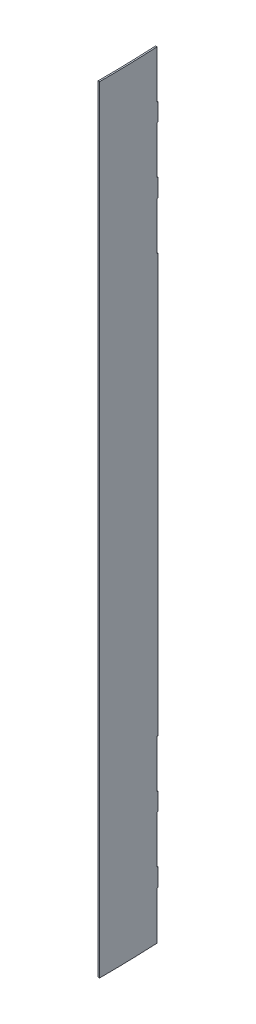
from build123d import *

# Parameters (mm, degrees)
BASE_FLANGE1_DEPTH        = 130
UNFOLD1_DEPTH             = 130
UNFOLD1_2_DEPTH           = 130
SKETCH6_W                 = 0.3
SKETCH6_H                 = 8
CUT_EXTRUDE1_DEPTH        = 235.985371885
LPATTERN1_COUNT           = 3
LPATTERN1_PITCH           = 11
LPATTERN2_COUNT           = 3
LPATTERN2_PITCH           = 100
LPATTERN2_COPY_1_SKETCH_W = 0.3
LPATTERN2_COPY_1_SKETCH_H = 8
LPATTERN2_COPY_1_DEPTH    = 235.985371885
LPATTERN2_COPY_2_SKETCH_W = 0.3
LPATTERN2_COPY_2_SKETCH_H = 8
LPATTERN2_COPY_2_DEPTH    = 235.985371885
LPATTERN2_COPY_3_SKETCH_W = 0.3
LPATTERN2_COPY_3_SKETCH_H = 8
LPATTERN2_COPY_3_DEPTH    = 235.985371885
LPATTERN2_COPY_4_SKETCH_W = 0.3
LPATTERN2_COPY_4_SKETCH_H = 8
LPATTERN2_COPY_4_DEPTH    = 235.985371885
FOLD1_DEPTH               = 130
FOLD1_2_DEPTH             = 130
FOLD1_START               = 30
FOLD1_3_DEPTH             = 70
FOLD1_START_2             = 8
FOLD1_4_DEPTH             = 3
FOLD1_START_3             = 19
FOLD1_5_DEPTH             = 3
FOLD1_START_4             = 108
FOLD1_6_DEPTH             = 3
FOLD1_START_5             = 119
FOLD1_7_DEPTH             = 3


# Read off the part's stored shape, not the designer's step: Unfold1, Fold1
# Sheet-metal steps are written as plain solids
with BuildPart() as part:
    # Sketch1 → Base-Flange1 (new body)
    with BuildSketch(Plane(origin=(0, 0, 0), x_dir=(1, 0, 0), z_dir=(0, 1, 0))):
        with BuildLine():
            ThreePointArc((195.5, 0), (195.436009031, 5.001637134), (195.244078015, 10))
            Line((195.244078015, 10), (195.493750749, 10.012787724))
            ThreePointArc((195.493750749, 10.012787724), (195.685927201, 5.008033089), (195.75, 0))
            Line((195.75, 0), (195.5, 0))
        make_face()
    extrude(amount=BASE_FLANGE1_DEPTH)

    # Unfold1 outline → Unfold1 (cut)
    with BuildSketch(Plane(origin=(0, 0, 0), x_dir=(1, 0, 0), z_dir=(0, 1, 0))):
        with BuildLine():
            Line((195.5, 0), (195.5, 9.890020218))
            ThreePointArc((195.5, 9.890020218), (195.496885011, 9.951404462), (195.493750749, 10.012787724))
            Line((195.493750749, 10.012787724), (195.244078015, 10))
            ThreePointArc((195.244078015, 10), (195.436009031, 5.001637134), (195.5, 0))
        make_face()
    extrude(amount=UNFOLD1_DEPTH, mode=Mode.SUBTRACT)

    # Unfold1 2 outline → Unfold1 2 (add)
    with BuildSketch(Plane(origin=(0, 0, 0), x_dir=(1, 0, 0), z_dir=(0, 1, 0))):
        with BuildLine():
            Line((195.75, 0), (195.75, 10.010762486))
            Line((195.75, 10.010762486), (195.5, 10.010762486))
            Line((195.5, 10.010762486), (195.5, 9.890020218))
            ThreePointArc((195.5, 9.890020218), (195.687490019, 4.946589732), (195.75, 0))
        make_face()
    extrude(amount=UNFOLD1_2_DEPTH)

    # Sketch6 → Cut-Extrude1 (cut, symmetric)
    with BuildSketch(Plane(origin=(195.75, 0, -195.75), x_dir=(0, 0, 1), z_dir=(-1, 0, 0))):
        with Locations((185.739237514, 126)):
            Rectangle(SKETCH6_W, SKETCH6_H)
    cut_extrude1 = extrude(amount=CUT_EXTRUDE1_DEPTH, both=True, mode=Mode.SUBTRACT)

    # LPattern1: Cut-Extrude1 ×3
    with Locations(*[(0, -i * LPATTERN1_PITCH, 0) for i in range(1, LPATTERN1_COUNT)]):
        add(cut_extrude1, mode=Mode.SUBTRACT)

    # LPattern2: Cut-Extrude1 ×3
    with Locations(*[(0, -i * LPATTERN2_PITCH, 0) for i in range(1, LPATTERN2_COUNT)]):
        add(cut_extrude1, mode=Mode.SUBTRACT)

    # LPattern2 copy 1 sketch → LPattern2 copy 1 (cut, symmetric)
    with BuildSketch(Plane(origin=(195.75, -111, -195.75), x_dir=(0, 0, 1), z_dir=(-1, 0, 0))):
        with Locations((185.739237514, 126)):
            Rectangle(LPATTERN2_COPY_1_SKETCH_W, LPATTERN2_COPY_1_SKETCH_H)
    extrude(amount=LPATTERN2_COPY_1_DEPTH, both=True, mode=Mode.SUBTRACT)

    # LPattern2 copy 2 sketch → LPattern2 copy 2 (cut, symmetric)
    with BuildSketch(Plane(origin=(195.75, -211, -195.75), x_dir=(0, 0, 1), z_dir=(-1, 0, 0))):
        with Locations((185.739237514, 126)):
            Rectangle(LPATTERN2_COPY_2_SKETCH_W, LPATTERN2_COPY_2_SKETCH_H)
    extrude(amount=LPATTERN2_COPY_2_DEPTH, both=True, mode=Mode.SUBTRACT)

    # LPattern2 copy 3 sketch → LPattern2 copy 3 (cut, symmetric)
    with BuildSketch(Plane(origin=(195.75, -122, -195.75), x_dir=(0, 0, 1), z_dir=(-1, 0, 0))):
        with Locations((185.739237514, 126)):
            Rectangle(LPATTERN2_COPY_3_SKETCH_W, LPATTERN2_COPY_3_SKETCH_H)
    extrude(amount=LPATTERN2_COPY_3_DEPTH, both=True, mode=Mode.SUBTRACT)

    # LPattern2 copy 4 sketch → LPattern2 copy 4 (cut, symmetric)
    with BuildSketch(Plane(origin=(195.75, -222, -195.75), x_dir=(0, 0, 1), z_dir=(-1, 0, 0))):
        with Locations((185.739237514, 126)):
            Rectangle(LPATTERN2_COPY_4_SKETCH_W, LPATTERN2_COPY_4_SKETCH_H)
    extrude(amount=LPATTERN2_COPY_4_DEPTH, both=True, mode=Mode.SUBTRACT)

    # Fold1 outline → Fold1 (cut)
    with BuildSketch(Plane(origin=(0, 0, 0), x_dir=(1, 0, 0), z_dir=(0, 1, 0))):
        with BuildLine():
            ThreePointArc((195.5, 9.890020218), (195.687490019, 4.946589732), (195.75, 0))
            Line((195.75, 0), (195.75, 10.010762486))
            Line((195.75, 10.010762486), (195.5, 10.010762486))
            Line((195.5, 10.010762486), (195.5, 9.890020218))
        make_face()
    extrude(amount=FOLD1_DEPTH, mode=Mode.SUBTRACT)

    # Fold1 2 outline → Fold1 2 (add)
    with BuildSketch(Plane(origin=(0, 0, 0), x_dir=(1, 0, 0), z_dir=(0, 1, 0))):
        with BuildLine():
            ThreePointArc((195.25168835, 9.850289156), (195.437912228, 4.926709225), (195.5, 0))
            Line((195.5, 0), (195.5, 9.860762486))
            Line((195.5, 9.860762486), (195.501477905, 9.860762486))
            ThreePointArc((195.501477905, 9.860762486), (195.501424363, 9.86182396), (195.501370816, 9.862885433))
            Line((195.501370816, 9.862885433), (195.25168835, 9.850289156))
        make_face()
    extrude(amount=FOLD1_2_DEPTH)

    # Fold1 3 outline → Fold1 3 (add)
    with BuildSketch(Plane(origin=(0, 0, 0), x_dir=(1, 0, 0), z_dir=(0, 1, 0)).offset(FOLD1_START)):
        with BuildLine():
            ThreePointArc((195.244078015, 10), (195.247897532, 9.925145307), (195.25168835, 9.850289156))
            Line((195.25168835, 9.850289156), (195.5, 9.862816276))
            Line((195.5, 9.862816276), (195.5, 9.890020218))
            ThreePointArc((195.5, 9.890020218), (195.496885011, 9.951404462), (195.493750749, 10.012787724))
            Line((195.493750749, 10.012787724), (195.244078015, 10))
        make_face()
    extrude(amount=FOLD1_3_DEPTH)

    # Fold1 4 outline → Fold1 4 (add)
    with BuildSketch(Plane(origin=(0, 0, 0), x_dir=(1, 0, 0), z_dir=(0, 1, 0)).offset(FOLD1_START_2)):
        with BuildLine():
            ThreePointArc((195.244078015, 10), (195.247897532, 9.925145307), (195.25168835, 9.850289156))
            Line((195.25168835, 9.850289156), (195.5, 9.862816276))
            Line((195.5, 9.862816276), (195.5, 9.890020218))
            ThreePointArc((195.5, 9.890020218), (195.496885011, 9.951404462), (195.493750749, 10.012787724))
            Line((195.493750749, 10.012787724), (195.244078015, 10))
        make_face()
    extrude(amount=FOLD1_4_DEPTH)

    # Fold1 5 outline → Fold1 5 (add)
    with BuildSketch(Plane(origin=(0, 0, 0), x_dir=(1, 0, 0), z_dir=(0, 1, 0)).offset(FOLD1_START_3)):
        with BuildLine():
            ThreePointArc((195.244078015, 10), (195.247897532, 9.925145307), (195.25168835, 9.850289156))
            Line((195.25168835, 9.850289156), (195.5, 9.862816276))
            Line((195.5, 9.862816276), (195.5, 9.890020218))
            ThreePointArc((195.5, 9.890020218), (195.496885011, 9.951404462), (195.493750749, 10.012787724))
            Line((195.493750749, 10.012787724), (195.244078015, 10))
        make_face()
    extrude(amount=FOLD1_5_DEPTH)

    # Fold1 6 outline → Fold1 6 (add)
    with BuildSketch(Plane(origin=(0, 0, 0), x_dir=(1, 0, 0), z_dir=(0, 1, 0)).offset(FOLD1_START_4)):
        with BuildLine():
            ThreePointArc((195.244078015, 10), (195.247897532, 9.925145307), (195.25168835, 9.850289156))
            Line((195.25168835, 9.850289156), (195.5, 9.862816276))
            Line((195.5, 9.862816276), (195.5, 9.890020218))
            ThreePointArc((195.5, 9.890020218), (195.496885011, 9.951404462), (195.493750749, 10.012787724))
            Line((195.493750749, 10.012787724), (195.244078015, 10))
        make_face()
    extrude(amount=FOLD1_6_DEPTH)

    # Fold1 7 outline → Fold1 7 (add)
    with BuildSketch(Plane(origin=(0, 0, 0), x_dir=(1, 0, 0), z_dir=(0, 1, 0)).offset(FOLD1_START_5)):
        with BuildLine():
            ThreePointArc((195.244078015, 10), (195.247897532, 9.925145307), (195.25168835, 9.850289156))
            Line((195.25168835, 9.850289156), (195.5, 9.862816276))
            Line((195.5, 9.862816276), (195.5, 9.890020218))
            ThreePointArc((195.5, 9.890020218), (195.496885011, 9.951404462), (195.493750749, 10.012787724))
            Line((195.493750749, 10.012787724), (195.244078015, 10))
        make_face()
    extrude(amount=FOLD1_7_DEPTH)


solid = part.part
